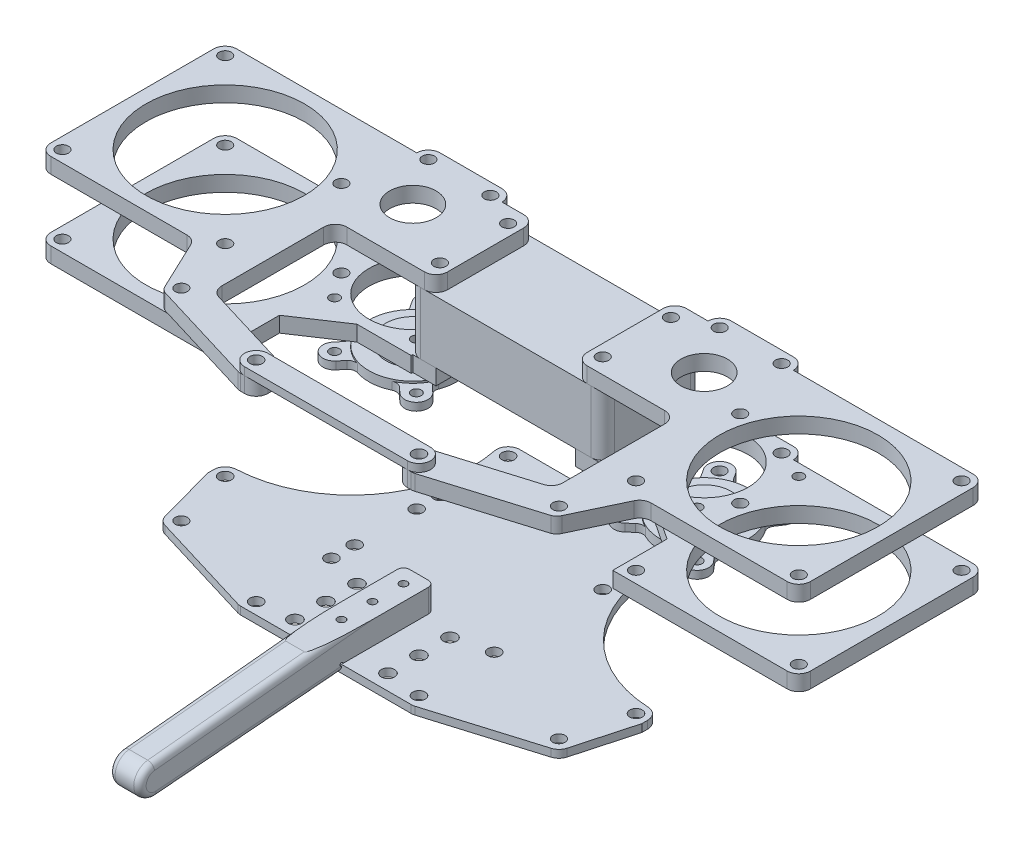
from build123d import *
from build123d.topology import SkipClean

# Parameters (mm, degrees)
BOSS_EXTRUDE1_DEPTH      = 9.525
SKETCH7_R                = 32.5
SKETCH7_R_2              = 9.525
BOSS_EXTRUDE2_DEPTH      = 6.35
SKETCH8_R                = 32.5
SKETCH8_R_2              = 18
BOSS_EXTRUDE3_DEPTH      = 6.35
BOSS_EXTRUDE4_DEPTH      = 6.35
BOSS_EXTRUDE5_START      = 31.75
BOSS_EXTRUDE5_DEPTH      = 6.35
SKETCH15_R               = 2.4892
CUT_EXTRUDE9_DEPTH       = 178.374267088
SKETCH16_R               = 6.35
CUT_EXTRUDE10_DEPTH      = 9.525
SKETCH19_R               = 2.0193
CUT_EXTRUDE11_DEPTH      = 178.374267088
SKETCH22_R               = 2.0193
CUT_EXTRUDE12_DEPTH      = 6.35
CHAMFER1_SIZE            = 12.7
CHAMFER1_SIZE2           = 19.05
SKETCH17_R               = 6.35
BOSS_EXTRUDE6_DEPTH      = 76.2
SKETCH24_W               = 76.2
SKETCH24_H               = 114.3
SKETCH24_R               = 2.5527
BOSS_EXTRUDE8_DEPTH      = 3.175
SKETCH25_W               = 25.4
SKETCH25_H               = 50.8
CUT_EXTRUDE13_DEPTH      = 178.374267088
SKETCH34_R               = 2.0193
CUT_EXTRUDE20_DEPTH      = 6.35
SKETCH21_R               = 2.5527
SKETCH21_R_2             = 2.4892
BOSS_EXTRUDE7_DEPTH      = 3.175
SKETCH26_W               = 57.15
SKETCH26_H               = 41.275
SKETCH26_R               = 18
BOSS_EXTRUDE9_DEPTH      = 9.525
SKETCH27_R               = 2.5527
CUT_EXTRUDE14_DEPTH      = 192.897168101
SKETCH28_W               = 11.1125
SKETCH28_H               = 4.7625
CUT_EXTRUDE15_DEPTH      = 228.583503906
SKETCH30_R               = 2.5527
CUT_EXTRUDE16_DEPTH      = 194.284236941
CUT_EXTRUDE17_REACH      = 193.897
CUT_EXTRUDE17_END_RADIUS = 18
SKETCH31_R               = 2.0193
SKETCH32_W               = 57.15
SKETCH32_H               = 0.254
CUT_EXTRUDE18_DEPTH      = 228.583503906
CUT_EXTRUDE19_DEPTH      = 3.175
FILLET1_R                = 4.7625
SKETCH35_R               = 2.0193
SKETCH35_R_2             = 2.4892
BOSS_EXTRUDE10_DEPTH     = 3.175
SKETCH36_R               = 18
BOSS_EXTRUDE11_DEPTH     = 0.762
SKETCH37_R               = 10.9982
BOSS_EXTRUDE12_DEPTH     = 2.413
SKETCH38_R               = 3.9878
CUT_EXTRUDE21_DEPTH      = 182.44784719
FILLET8_R                = 3.175
SKETCH39_R               = 12.7
CUT_EXTRUDE22_DEPTH      = 3.175
SKETCH40_R               = 2.5527
BOSS_EXTRUDE13_DEPTH     = 6.35
CUT_EXTRUDE23_DEPTH      = 6.35
SKETCH43_W               = 79.375
SKETCH43_H               = 40.64
SKETCH43_R               = 2.4892
BOSS_EXTRUDE14_DEPTH     = 25.4
FILLET2_R                = 4.7625
FILLET3_R                = 4.7625
FILLET4_R                = 4.7625
BOSS_EXTRUDE15_DEPTH     = 6.35
SKETCH45_R               = 2.7051
CUT_EXTRUDE24_DEPTH      = 3.175
CUT_EXTRUDE25_DEPTH      = 3.175
FILLET5_R                = 4.7625
SKETCH47_R               = 2.5527
BOSS_EXTRUDE16_DEPTH     = 3.175
LPATTERN1_COUNT          = 2
LPATTERN1_PITCH          = 19.05
LPATTERN1_COL_COUNT      = 2
LPATTERN1_COL_PITCH      = 19.05
FILLET6_R                = 2.54
FILLET7_R                = 2.54
CUT_SWEEP1_PROFILE_R     = 0.635
SKETCH58_R               = 1.5875
CUT_EXTRUDE26_DEPTH      = 9.525


with BuildPart() as part:
    # Sketch6 → Boss-Extrude1 (new body)
    with BuildSketch(Plane(origin=(28.575, 0, 0), x_dir=(0, 0, -1), z_dir=(1, 0, 0))):
        Polygon((-76.2, 60.325), (-66.04, 92.075), (-62.865, 92.075), (-62.865, 85.725), (-34.29, 85.725), (-34.29, 92.075), (-2.54, 92.075), (-2.54, 85.725), (38.1, 85.725), (38.1, 60.325), (-2.54, 60.325), (-2.54, 53.975), (-76.2, 53.975), align=None)
    extrude(amount=BOSS_EXTRUDE1_DEPTH)

    # Sketch16 → Cut-Extrude10 (cut)
    with BuildSketch(Plane.ZY.offset(-28.575)):
        with Locations((18.415, 76.2)):
            Circle(SKETCH16_R)
    extrude(amount=-CUT_EXTRUDE10_DEPTH, mode=Mode.SUBTRACT)

    # Sketch19 → Cut-Extrude11 (cut, through all)
    with BuildSketch(Plane.XZ.offset(-53.975)):
        with Locations(Location((33.3375, -3.81, 0), (0, 0, 270))):
            Circle(SKETCH19_R)
        with Locations(Location((33.3375, -31.75, 0), (0, 0, 270))):
            Circle(SKETCH19_R)
        with Locations(Location((33.3375, 40.64, 0), (0, 0, 270))):
            Circle(SKETCH19_R)
        with Locations(Location((33.3375, 71.4375, 0), (0, 0, 270))):
            Circle(SKETCH19_R)
        with Locations(Location((33.3375, 56.515, 0), (0, 0, 270))):
            Circle(SKETCH19_R)
    extrude(amount=-CUT_EXTRUDE11_DEPTH, mode=Mode.SUBTRACT)


with BuildPart() as body_2:
    # Sketch7 → Boss-Extrude2 (new body)
    with BuildSketch(Plane(origin=(0, 85.725, 0), x_dir=(1, 0, 0), z_dir=(0, 1, 0))):
        Polygon((28.575, -62.865), (80.340904861, -62.865), (92.075, -38.1), (117.475, -38.1), (155.575, -38.1), (155.575, 38.1), (28.575, 38.1), (28.575, -2.54), (38.1, -2.54), (38.1, -34.29), (28.575, -34.29), align=None)
        with Locations(Location((117.475, 0, 0), (0, 0, 90))):
            Circle(SKETCH7_R, mode=Mode.SUBTRACT)
        with Locations(Location((59.658933489, 19.05, 0), (0, 0, 90))):
            Circle(SKETCH7_R_2, mode=Mode.SUBTRACT)
    extrude(amount=BOSS_EXTRUDE2_DEPTH)

    # Sketch14<2> → Boss-Extrude5 (add)
    with BuildSketch(Plane(origin=(0, 60.325, 0), x_dir=(1, 0, 0), z_dir=(0, 1, 0)).offset(BOSS_EXTRUDE5_START)):
        with BuildLine():
            Line((72.358933489, 42.8625), (46.958933489, 42.8625))
            ThreePointArc((46.958933489, 42.8625), (43.591337443, 34.732403955), (51.721433489, 38.1))
            Line((51.721433489, 38.1), (67.596433489, 38.1))
            ThreePointArc((67.596433489, 38.1), (75.726529534, 34.732403955), (72.358933489, 42.8625))
        make_face()
    extrude(amount=-BOSS_EXTRUDE5_DEPTH)


with BuildPart() as body_3:
    # Sketch8 → Boss-Extrude3 (new body)
    with BuildSketch(Plane(origin=(0, 60.325, 0), x_dir=(-1, 0, 0), z_dir=(0, -1, 0))):
        Polygon((-79.375, -38.1), (-155.575, -38.1), (-155.575, 38.1), (-79.375, 38.1), (-28.575, 38.1), (-28.575, -2.54), (-38.1, -2.54), (-38.1, -3.175), (-79.375, -3.175), align=None)
        with Locations(Location((-117.475, 0, 0), (0, 0, 90))):
            Circle(SKETCH8_R, mode=Mode.SUBTRACT)
        with Locations(Location((-59.658933489, 19.05, 0), (0, 0, 90))):
            Circle(SKETCH8_R_2, mode=Mode.SUBTRACT)
    extrude(amount=BOSS_EXTRUDE3_DEPTH)

    # Sketch14 → Boss-Extrude4 (add)
    with BuildSketch(Plane(origin=(0, 60.325, 0), x_dir=(1, 0, 0), z_dir=(0, 1, 0))):
        with BuildLine():
            Line((72.358933489, 42.8625), (46.958933489, 42.8625))
            ThreePointArc((46.958933489, 42.8625), (43.591337443, 34.732403955), (51.721433489, 38.1))
            Line((51.721433489, 38.1), (67.596433489, 38.1))
            ThreePointArc((67.596433489, 38.1), (75.726529534, 34.732403955), (72.358933489, 42.8625))
        make_face()
    extrude(amount=-BOSS_EXTRUDE4_DEPTH)


with BuildPart() as cut_extrude9_tool:
    # Sketch15 → Cut-Extrude9 (new, through all)
    with BuildSketch(Plane.XZ.offset(-53.975)):
        with Locations(Location((46.958933489, -38.1, 0), (0, 0, 270))):
            Circle(SKETCH15_R)
        with Locations(Location((72.358933489, -38.1, 0), (0, 0, 270))):
            Circle(SKETCH15_R)
        with Locations(Location((81.681121209, -11.793839189, 0), (0, 0, 270))):
            Circle(SKETCH15_R)
        with Locations(Location((150.8125, -33.3375, 0), (0, 0, 270))):
            Circle(SKETCH15_R)
        with Locations(Location((150.8125, 33.3375, 0), (0, 0, 270))):
            Circle(SKETCH15_R)
        with Locations(Location((84.1375, 33.3375, 0), (0, 0, 270))):
            Circle(SKETCH15_R)
        with Locations(Location((33.3375, -31.75, 0), (0, 0, 270))):
            Circle(SKETCH15_R)
        with Locations(Location((33.3375, -3.81, 0), (0, 0, 270))):
            Circle(SKETCH15_R)
        with Locations(Location((33.3375, 40.64, 0), (0, 0, 270))):
            Circle(SKETCH15_R)
        with Locations(Location((77.327408996, 58.1025, 0), (0, 0, 270))):
            Circle(SKETCH15_R)
        with Locations(Location((33.3375, 56.515, 0), (0, 0, 270))):
            Circle(SKETCH15_R)
        with BuildLine():
            Line((150.8125, 38.1), (155.575, 38.1))
            Line((155.575, 38.1), (155.575, 33.3375))
            ThreePointArc((155.575, 33.3375), (154.180096045, 36.705096045), (150.8125, 38.1))
        make_face()
        with BuildLine():
            Line((150.8125, -38.1), (155.575, -38.1))
            Line((155.575, -38.1), (155.575, -33.3375))
            ThreePointArc((155.575, -33.3375), (154.180096045, -36.705096045), (150.8125, -38.1))
        make_face()
    extrude(amount=-CUT_EXTRUDE9_DEPTH)


with BuildPart() as body_3_1:
    add(body_3.part)

    # Cut-Extrude9: cut by cut_extrude9_tool
    add(cut_extrude9_tool.part, mode=Mode.SUBTRACT)

    # Sketch22 → Cut-Extrude12 (cut)
    with BuildSketch(Plane.XZ.offset(-53.975)):
        with Locations(Location((84.1375, -33.3375, 0), (0, 0, 270))):
            Circle(SKETCH22_R)
    extrude(amount=-CUT_EXTRUDE12_DEPTH, mode=Mode.SUBTRACT)

    # Chamfer1
    chamfer1_edges = [body_3_1.edges().sort_by_distance(p)[0] for p in [
        (79.375, 57.15, 3.175),
    ]]
    chamfer1_side = [body_3_1.faces().sort_by_distance(p)[0] for p in [
        (79.375, 57.15, 20.6375),
    ]]
    chamfer(chamfer1_edges, length=CHAMFER1_SIZE, length2=CHAMFER1_SIZE2, reference=chamfer1_side[0])


with BuildPart() as body_2_1:
    add(body_2.part)

    # Cut-Extrude9: cut by cut_extrude9_tool
    add(cut_extrude9_tool.part, mode=Mode.SUBTRACT)


with BuildPart() as body_4:
    # Mirror2: mirrored copy
    add(part.part.mirror(Plane(origin=(0, 0, 0), x_dir=(0, 0, 1), z_dir=(1, 0, 0))))


with BuildPart() as body_5:
    # Mirror2 2: mirrored copy
    add(body_2_1.part.mirror(Plane(origin=(0, 0, 0), x_dir=(0, 0, 1), z_dir=(1, 0, 0))))


with BuildPart() as body_6:
    # Mirror2 3: mirrored copy
    add(body_3_1.part.mirror(Plane(origin=(0, 0, 0), x_dir=(0, 0, 1), z_dir=(1, 0, 0))))


with BuildPart() as body_7:
    # Sketch17 → Boss-Extrude6 (new body)
    with BuildSketch(Plane(origin=(38.1, 0, 0), x_dir=(0, 0, -1), z_dir=(1, 0, 0))):
        with Locations((-18.415, 76.2)):
            Circle(SKETCH17_R)
    extrude(amount=-BOSS_EXTRUDE6_DEPTH)


with BuildPart() as body_8:
    # Sketch24 → Boss-Extrude8 (new body)
    with BuildSketch(Plane.XZ.offset(-53.975)):
        with Locations((0, 19.05)):
            Rectangle(SKETCH24_W, SKETCH24_H)
        with Locations(Location((-33.3375, 71.4375, 0), (0, 0, 270))):
            Circle(SKETCH24_R, mode=Mode.SUBTRACT)
        with Locations(Location((33.3375, 71.4375, 0), (0, 0, 270))):
            Circle(SKETCH24_R, mode=Mode.SUBTRACT)
        with Locations(Location((33.3375, 40.64, 0), (0, 0, 270))):
            Circle(SKETCH24_R, mode=Mode.SUBTRACT)
        with Locations(Location((-33.3375, 40.64, 0), (0, 0, 270))):
            Circle(SKETCH24_R, mode=Mode.SUBTRACT)
        with Locations(Location((-33.3375, -3.81, 0), (0, 0, 270))):
            Circle(SKETCH24_R, mode=Mode.SUBTRACT)
        with Locations(Location((33.3375, -3.81, 0), (0, 0, 270))):
            Circle(SKETCH24_R, mode=Mode.SUBTRACT)
        with Locations(Location((33.3375, -31.75, 0), (0, 0, 270))):
            Circle(SKETCH24_R, mode=Mode.SUBTRACT)
        with Locations(Location((-33.3375, -31.75, 0), (0, 0, 270))):
            Circle(SKETCH24_R, mode=Mode.SUBTRACT)
        with Locations(Location((33.3375, 56.515, 0), (0, 0, 270))):
            Circle(SKETCH24_R, mode=Mode.SUBTRACT)
        with Locations(Location((-33.3375, 56.515, 0), (0, 0, 270))):
            Circle(SKETCH24_R, mode=Mode.SUBTRACT)
    extrude(amount=BOSS_EXTRUDE8_DEPTH)

    # Sketch25 → Cut-Extrude13 (cut, through all)
    with BuildSketch(Plane(origin=(0, 53.975, 0), x_dir=(1, 0, 0), z_dir=(0, 1, 0))):
        with Locations((-6.35, -18.415)):
            Rectangle(SKETCH25_W, SKETCH25_H)
    extrude(amount=-CUT_EXTRUDE13_DEPTH, mode=Mode.SUBTRACT)


with BuildPart() as cut_extrude20_tool:
    # Sketch34 → Cut-Extrude20 (new body)
    with BuildSketch(Plane.XZ.offset(-53.975)):
        with Locations(Location((74.26004646, -1.5875, 0), (0, 0, 270))):
            Circle(SKETCH34_R)
        with Locations(Location((-74.26004646, -1.5875, 0), (0, 0, 270))):
            Circle(SKETCH34_R)
        with Locations(Location((42.8625, -3.687343058, 0), (0, 0, 270))):
            Circle(SKETCH34_R)
        with Locations(Location((-42.8625, -3.687343058, 0), (0, 0, 270))):
            Circle(SKETCH34_R)
    extrude(amount=-CUT_EXTRUDE20_DEPTH)


with BuildPart() as body_3_2:
    add(body_3_1.part)

    # Cut-Extrude20: cut by cut_extrude20_tool
    add(cut_extrude20_tool.part, mode=Mode.SUBTRACT)


with BuildPart() as body_6_1:
    add(body_6.part)

    # Cut-Extrude20: cut by cut_extrude20_tool
    add(cut_extrude20_tool.part, mode=Mode.SUBTRACT)


with BuildPart() as body_9:
    # Sketch21 → Boss-Extrude7 (new body)
    with BuildSketch(Plane(origin=(0, 9.525, 0), x_dir=(-1, 0, 0), z_dir=(0, -1, 0))):
        Polygon((-88.9, -35.71875), (-88.9, 38.251152997), (-33.263104096, 36.5125), (33.263104096, 36.5125), (88.9, 38.251152997), (88.9, -35.71875), (81.599955368, -62.265473852), (35.632311037, -76.2), (34.925, -76.2), (-34.925, -76.2), (-35.632311037, -76.2), (-81.599955368, -62.265473852), align=None)
        with Locations(Location((-84.1375, 33.3375, 0), (0, 0, 90))):
            Circle(SKETCH21_R, mode=Mode.SUBTRACT)
        with Locations(Location((-84.1375, -33.3375, 0), (0, 0, 90))):
            Circle(SKETCH21_R, mode=Mode.SUBTRACT)
        with Locations(Location((-33.3375, 31.75, 0), (0, 0, 90))):
            Circle(SKETCH21_R, mode=Mode.SUBTRACT)
        with Locations(Location((-33.3375, 3.81, 0), (0, 0, 90))):
            Circle(SKETCH21_R, mode=Mode.SUBTRACT)
        with Locations(Location((-33.3375, -40.64, 0), (0, 0, 90))):
            Circle(SKETCH21_R, mode=Mode.SUBTRACT)
        with Locations(Location((-33.3375, -71.4375, 0), (0, 0, 90))):
            Circle(SKETCH21_R, mode=Mode.SUBTRACT)
        with Locations(Location((33.3375, -71.4375, 0), (0, 0, 90))):
            Circle(SKETCH21_R, mode=Mode.SUBTRACT)
        with Locations(Location((33.3375, -40.64, 0), (0, 0, 90))):
            Circle(SKETCH21_R, mode=Mode.SUBTRACT)
        with Locations(Location((33.3375, 3.81, 0), (0, 0, 90))):
            Circle(SKETCH21_R, mode=Mode.SUBTRACT)
        with Locations(Location((33.3375, 31.75, 0), (0, 0, 90))):
            Circle(SKETCH21_R, mode=Mode.SUBTRACT)
        with Locations(Location((84.1375, 33.3375, 0), (0, 0, 90))):
            Circle(SKETCH21_R, mode=Mode.SUBTRACT)
        with Locations(Location((84.1375, -33.3375, 0), (0, 0, 90))):
            Circle(SKETCH21_R, mode=Mode.SUBTRACT)
        with Locations(Location((-77.327408996, -58.1025, 0), (0, 0, 90))):
            Circle(SKETCH21_R_2, mode=Mode.SUBTRACT)
        with Locations(Location((-74.26004646, 1.5875, 0), (0, 0, 90))):
            Circle(SKETCH21_R, mode=Mode.SUBTRACT)
        with Locations(Location((74.26004646, 1.5875, 0), (0, 0, 90))):
            Circle(SKETCH21_R, mode=Mode.SUBTRACT)
        with Locations(Location((-42.8625, 3.687343058, 0), (0, 0, 90))):
            Circle(SKETCH21_R, mode=Mode.SUBTRACT)
        with Locations(Location((42.8625, 3.687343058, 0), (0, 0, 90))):
            Circle(SKETCH21_R, mode=Mode.SUBTRACT)
        with Locations(Location((77.327408996, -58.1025, 0), (0, 0, 90))):
            Circle(SKETCH21_R_2, mode=Mode.SUBTRACT)
    extrude(amount=BOSS_EXTRUDE7_DEPTH)

    # Sketch30 → Cut-Extrude16 (cut, through all)
    with BuildSketch(Plane.XZ.offset(-6.35)):
        with Locations(Location((-33.3375, 31.115, 0), (0, 0, 270))):
            Circle(SKETCH30_R)
        with Locations(Location((-33.3375, 5.715, 0), (0, 0, 270))):
            Circle(SKETCH30_R)
    extrude(amount=-CUT_EXTRUDE16_DEPTH, mode=Mode.SUBTRACT)

    # Sketch33 → Cut-Extrude19 (cut)
    with BuildSketch(Plane.XZ.offset(-6.35)):
        with BuildLine():
            Line((88.9, -25.200781238), (88.9, 25.200781238))
            ThreePointArc((88.9, 25.200781238), (79.375, 0), (88.9, -25.200781238))
        make_face()
        with BuildLine():
            Line((-88.9, -25.200781238), (-88.9, 25.200781238))
            ThreePointArc((-88.9, 25.200781238), (-79.375, 0), (-88.9, -25.200781238))
        make_face()
    extrude(amount=-CUT_EXTRUDE19_DEPTH, mode=Mode.SUBTRACT)

    # Fillet1
    fillet1_edges = [body_9.edges().sort_by_distance(p)[0] for p in [
        (88.9, 7.9375, -25.200781238),
        (88.9, 7.9375, 25.200781238),
        (-88.9, 7.9375, 25.200781238),
        (-88.9, 7.9375, -25.200781238),
        (88.9, 7.9375, -38.251152997),
        (-88.9, 7.9375, -38.251152997),
        (-81.599955368, 7.9375, 62.265473852),
        (-35.632311037, 7.9375, 76.2),
        (35.632311037, 7.9375, 76.2),
        (81.599955368, 7.9375, 62.265473852),
    ]]
    fillet(fillet1_edges, radius=FILLET1_R)

    # Sketch39 → Cut-Extrude22 (cut)
    with BuildSketch(Plane.XZ.offset(-6.35)):
        with Locations(Location((-59.658933489, -19.05, 0), (0, 0, 270))):
            Circle(SKETCH39_R)
        with Locations(Location((59.658933489, -19.05, 0), (0, 0, 270))):
            Circle(SKETCH39_R)
    extrude(amount=-CUT_EXTRUDE22_DEPTH, mode=Mode.SUBTRACT)

    # Sketch45 → Cut-Extrude24 (cut)
    with BuildSketch(Plane.XZ.offset(-6.35)):
        with Locations(Location((0, 44.45, 0), (0, 0, 270))):
            Circle(SKETCH45_R)
        with Locations(Location((0, 57.15, 0), (0, 0, 270))):
            Circle(SKETCH45_R)
        with Locations(Location((0, 69.85, 0), (0, 0, 270))):
            Circle(SKETCH45_R)
    cut_extrude24 = extrude(amount=-CUT_EXTRUDE24_DEPTH, mode=Mode.SUBTRACT)

    # Sketch46 → Cut-Extrude25 (cut)
    with BuildSketch(Plane.XZ.offset(-6.35)):
        with BuildLine():
            ThreePointArc((-88.9, 28.579513852), (-47.105461685, 9.009143374), (-39.518445268, -36.5125))
            ThreePointArc((-39.518445268, -36.5125), (-126.13961151, -50.94950538), (-88.9, 28.579513852))
        make_face()
    cut_extrude25 = extrude(amount=-CUT_EXTRUDE25_DEPTH, mode=Mode.SUBTRACT)

    # Mirror4: Cut-Extrude25 across plane
    add(cut_extrude25.mirror(Plane(origin=(0, 0, 0), x_dir=(0, 0, 1), z_dir=(1, 0, 0))), mode=Mode.SUBTRACT)

    # Fillet5
    # the kernel refuses this fillet: 4.7625 mm, written as the material it takes off along each edge
    with BuildSketch(Plane(origin=(-88.9, -5.54496537, 28.579513852), x_dir=(0, 0, 1), z_dir=(0, 1, 0))) as fillet5_piece_1:
        with BuildLine():
            CenterArc((4.757986148, 4.7625), FILLET5_R, 182.619939868, 87.380060132)
            Line((0.000464283, 4.54480306), (-0.094686154, 4.540449122))
            ThreePointArc((-0.094686154, 4.540449122), (-0.0429381, 2.27240594), (-0.095149546, 0.004373379))
            Line((-0.095149546, 0.004373379), (0, -0.09525))
            Line((0, -0.09525), (4.757986148, -0.09525))
            Line((4.757986148, -0.09525), (4.757986148, 0))
        make_face()
    extrude(amount=26.964930741, mode=Mode.SUBTRACT)
    with BuildSketch(Plane(origin=(88.9, -5.54496537, 28.579513852), x_dir=(0, 0, 1), z_dir=(0, 1, 0))) as fillet5_piece_2:
        with BuildLine():
            CenterArc((4.757986148, -4.7625), FILLET5_R, 90, 87.380060132)
            Line((0.000464283, -4.54480306), (-0.094686154, -4.540449122))
            ThreePointArc((-0.094686154, -4.540449122), (-0.0429381, -2.27240594), (-0.095149546, -0.004373379))
            Line((-0.095149546, -0.004373379), (0, 0.09525))
            Line((0, 0.09525), (4.757986148, 0.09525))
            Line((4.757986148, 0.09525), (4.757986148, 0))
        make_face()
    extrude(amount=26.964930741, mode=Mode.SUBTRACT)
    with BuildSketch(Plane(origin=(39.584081734, 25.335158249, -36.710030551), x_dir=(-0.999512076087079, 0, 0.031234752377718233), z_dir=(0, -1, 0))) as fillet5_piece_3:
        with BuildLine():
            CenterArc((6.398323114, -4.761921013), FILLET5_R, 90.893427068, 102.333962985)
            Line((1.762174005, -5.851658451), (1.669451023, -5.8734532))
            ThreePointArc((1.669451023, -5.8734532), (0.880087853, -2.92613011), (-0.089339106, -0.033031602))
            Line((-0.089339106, -0.033031602), (0, 0.09525))
            Line((0, 0.09525), (6.322578103, 0.09523842))
            Line((6.322578103, 0.09523842), (6.3240633, 0))
        make_face()
    extrude(amount=34.795316498, mode=Mode.SUBTRACT)
    with BuildSketch(Plane(origin=(-39.584081734, 25.335158249, -36.710030551), x_dir=(0.25830126253387015, 0, 0.9660644169895757), z_dir=(0, -1, 0))) as fillet5_piece_4:
        with BuildLine():
            CenterArc((6.404615335, -4.75345483), FILLET5_R, 93.531809473, 102.333962985)
            Line((1.823543741, -6.055449186), (1.731922309, -6.081489073))
            Line((1.731922309, -6.081489073), (-0.091204263, -0.027465339))
            Line((-0.091204263, -0.027465339), (0.005867655, 0.095069097))
            ThreePointArc((0.005867655, 0.095069097), (3.055616298, 0.001043471), (6.105364942, 0.095069097))
            Line((6.105364942, 0.095069097), (6.111232597, 0))
        make_face()
    extrude(amount=34.795316498, mode=Mode.SUBTRACT)

    # LPattern1: Cut-Extrude24 ×2
    with Locations(*[(i * LPATTERN1_PITCH, 0, 0) for i in range(1, LPATTERN1_COUNT)]):
        add(cut_extrude24, mode=Mode.SUBTRACT)

    # LPattern1 col: Cut-Extrude24 ×2
    with Locations(*[(-i * LPATTERN1_COL_PITCH, 0, 0) for i in range(1, LPATTERN1_COL_COUNT)]):
        add(cut_extrude24, mode=Mode.SUBTRACT)


with BuildPart() as body_10:
    # Sketch26 → Boss-Extrude9 (new body)
    with BuildSketch(Plane.ZY.offset(38.1)):
        with Locations((18.415, 30.1625)):
            Rectangle(SKETCH26_W, SKETCH26_H)
        with Locations((18.415, 28.575)):
            Circle(SKETCH26_R, mode=Mode.SUBTRACT)
    extrude(amount=-BOSS_EXTRUDE9_DEPTH)

    # Sketch27 → Cut-Extrude14 (cut, through all)
    with BuildSketch(Plane.XZ.offset(-9.525)):
        with Locations(Location((-33.3375, -3.81, 0), (0, 0, 270))):
            Circle(SKETCH27_R)
        with Locations(Location((-33.3375, 40.64, 0), (0, 0, 270))):
            Circle(SKETCH27_R)
    extrude(amount=-CUT_EXTRUDE14_DEPTH, mode=Mode.SUBTRACT)

    # Sketch28 → Cut-Extrude15 (cut, through all)
    with BuildSketch(Plane.ZY.offset(38.1)):
        with Locations((-4.60375, 11.90625)):
            Rectangle(SKETCH28_W, SKETCH28_H)
        with Locations((41.43375, 11.90625)):
            Rectangle(SKETCH28_W, SKETCH28_H)
    extrude(amount=-CUT_EXTRUDE15_DEPTH, mode=Mode.SUBTRACT)

    # Cut-Extrude17: up to this cylinder (the profile starts outside it)
    cut_extrude17_end = Plane(origin=(-33.3375, 28.575, 18.415), z_dir=(-1, 0, 0)) * Cylinder(CUT_EXTRUDE17_END_RADIUS, 424.794, mode=Mode.PRIVATE)
    # Sketch31 → Cut-Extrude17 (cut, up to the surface)
    with BuildSketch(Plane.XZ.offset(-9.525), mode=Mode.PRIVATE) as cut_extrude17_sk1:
        with Locations(Location((-33.3375, 5.715, 0), (0, 0, 270))):
            Circle(SKETCH31_R)
    cut_extrude17_tool1 = extrude(cut_extrude17_sk1.sketch, amount=-CUT_EXTRUDE17_REACH, mode=Mode.PRIVATE) - cut_extrude17_end
    add(cut_extrude17_tool1.solids().sort_by_distance((-33.3375, 9.525, 5.715))[0], mode=Mode.SUBTRACT)
    # Sketch31 → Cut-Extrude17 (cut, up to the surface)
    with BuildSketch(Plane.XZ.offset(-9.525), mode=Mode.PRIVATE) as cut_extrude17_sk2:
        with Locations(Location((-33.3375, 31.115, 0), (0, 0, 270))):
            Circle(SKETCH31_R)
    cut_extrude17_tool2 = extrude(cut_extrude17_sk2.sketch, amount=-CUT_EXTRUDE17_REACH, mode=Mode.PRIVATE) - cut_extrude17_end
    add(cut_extrude17_tool2.solids().sort_by_distance((-33.3375, 9.525, 31.115))[0], mode=Mode.SUBTRACT)

    # Sketch32 → Cut-Extrude18 (cut, through all)
    with BuildSketch(Plane.ZY.offset(38.1)):
        with Locations((18.415, 28.575)):
            Rectangle(SKETCH32_W, SKETCH32_H)
    extrude(amount=-CUT_EXTRUDE18_DEPTH, mode=Mode.SUBTRACT)


with BuildPart() as cut_extrude18_piece_1:
    # of the separate pieces the step leaves, piece 1, a body of its own (cut_extrude18_pieces)
    add(body_10.part.solids().sort_by_distance((-38.1, 50.8, -10.16))[0])


with BuildPart() as cut_extrude18_piece_2:
    # of the separate pieces the step leaves, piece 2, a body of its own (cut_extrude18_pieces)
    add(body_10.part.solids().sort_by_distance((-38.1, 9.525, 0.9525))[0])


with BuildPart() as body_12:
    # Sketch35 → Boss-Extrude10 (new body)
    with BuildSketch(Plane(origin=(0, 41.275, 0), x_dir=(-1, 0, 0), z_dir=(0, -1, 0))):
        with BuildLine():
            Line((-77.913650249, 4.642428085), (-74.447248762, 8.788141914))
            ThreePointArc((-74.447248762, 8.788141914), (-77.632505883, 20.025036096), (-73.250353492, 30.85141103))
            Line((-73.250353492, 30.85141103), (-76.321573015, 35.458240315))
            ThreePointArc((-76.321573015, 35.458240315), (-75.000693173, 42.062639527), (-68.396293962, 40.741759685))
            Line((-68.396293962, 40.741759685), (-65.325074438, 36.134930399))
            ThreePointArc((-65.325074438, 36.134930399), (-59.658933489, 37.05), (-53.992792539, 36.134930399))
            Line((-53.992792539, 36.134930399), (-50.921573015, 40.741759685))
            ThreePointArc((-50.921573015, 40.741759685), (-44.317173804, 42.062639527), (-42.996293962, 35.458240315))
            Line((-42.996293962, 35.458240315), (-46.067513485, 30.85141103))
            ThreePointArc((-46.067513485, 30.85141103), (-41.790487399, 21.222241781), (-43.635822547, 10.848785714))
            Line((-43.635822547, 10.848785714), (-39.648237345, 7.201588615))
            ThreePointArc((-39.648237345, 7.201588615), (-39.348254443, 0.473080403), (-46.076762655, 0.173097501))
            Line((-46.076762655, 0.173097501), (-50.064347857, 3.8202946))
            ThreePointArc((-50.064347857, 3.8202946), (-58.45779099, 1.090120916), (-67.140041184, 2.678285745))
            Line((-67.140041184, 2.678285745), (-70.606442671, -1.467428085))
            ThreePointArc((-70.606442671, -1.467428085), (-77.314974544, -2.066103789), (-77.913650249, 4.642428085))
        make_face()
        with Locations(Location((-74.26004646, 1.5875, 0), (0, 0, 90))):
            Circle(SKETCH35_R, mode=Mode.SUBTRACT)
        with Locations(Location((-42.8625, 3.687343058, 0), (0, 0, 90))):
            Circle(SKETCH35_R, mode=Mode.SUBTRACT)
        with Locations(Location((-46.958933489, 38.1, 0), (0, 0, 90))):
            Circle(SKETCH35_R_2, mode=Mode.SUBTRACT)
        with Locations(Location((-72.358933489, 38.1, 0), (0, 0, 90))):
            Circle(SKETCH35_R_2, mode=Mode.SUBTRACT)
    extrude(amount=BOSS_EXTRUDE10_DEPTH)

    # Sketch36 → Boss-Extrude11 (add)
    with SkipClean():  # the faces are left unmerged after this step: merging them gives an invalid solid
        with BuildSketch(Plane(origin=(0, 41.275, 0), x_dir=(1, 0, 0), z_dir=(0, 1, 0))):
            with Locations(Location((59.658933489, 19.05, 0), (0, 0, 294.558183853))):
                Circle(SKETCH36_R)
        extrude(amount=BOSS_EXTRUDE11_DEPTH)

    # Sketch37 → Boss-Extrude12 (add)
    with SkipClean():  # the faces are left unmerged after this step: merging them gives an invalid solid
        with BuildSketch(Plane(origin=(0, 42.037, 0), x_dir=(1, 0, 0), z_dir=(0, 1, 0))):
            with Locations(Location((59.658933489, 19.05, 0), (0, 0, 90))):
                Circle(SKETCH37_R)
        extrude(amount=BOSS_EXTRUDE12_DEPTH)

    # Sketch38 → Cut-Extrude21 (cut, through all)
    with SkipClean():  # the faces are left unmerged after this step: merging them gives an invalid solid
        with BuildSketch(Plane.XZ.offset(-38.1)):
            with Locations(Location((59.658933489, -19.05, 0), (0, 0, 270))):
                Circle(SKETCH38_R)
        extrude(amount=-CUT_EXTRUDE21_DEPTH, mode=Mode.SUBTRACT)

    # Fillet8
    # the kernel refuses this fillet: 3.175 mm, written as the material it adds along each edge
    with BuildSketch(Plane(origin=(74.447248762, 41.275, -8.788141914), x_dir=(0.52132134384505, 0, -0.8533604493129449), z_dir=(0, -1, 0)), Plane(origin=(65.325074438, 41.275, -36.134930399), x_dir=(-0.9658744295384044, 0, -0.259010784261702), z_dir=(0, -1, 0))) as fillet8_piece_1:
        with BuildLine():
            CenterArc((2.279983772, 3.169618201), FILLET8_R, 198.67869384, 67.984808193)
            Line((-0.727787188, 2.152790363), (0, 0))
            ThreePointArc((0, 0), (1.047599436, 0.030510986), (2.095198871, 0))
        make_face()
    extrude(amount=3.175)
    with BuildSketch(Plane(origin=(73.250353492, 41.275, -30.85141103), x_dir=(0.5547001962252291, 0, -0.8320502943378437), z_dir=(0, -1, 0)), Plane(origin=(53.992792539, 41.275, -36.134930399), x_dir=(-0.5547001962252269, 0, -0.8320502943378452), z_dir=(0, -1, 0))) as fillet8_piece_2:
        with BuildLine():
            CenterArc((2.272483342, 3.175), FILLET8_R, 202.015191807, 67.984808193)
            ThreePointArc((-0.671009933, 1.984843566), (-0.306601011, 1.002193254), (0, 0))
            Line((0, 0), (2.272483342, 0))
        make_face()
    extrude(amount=3.175)
    with BuildSketch(Plane(origin=(46.067513485, 41.275, -30.85141103), x_dir=(-0.5547001962252291, 0, -0.8320502943378437), z_dir=(0, -1, 0)), Plane(origin=(50.064347857, 41.275, -3.8202946), x_dir=(-0.7378993295380093, 0, 0.6749107937108108), z_dir=(0, -1, 0))) as fillet8_piece_3:
        with BuildLine():
            CenterArc((2.272483342, -3.175), FILLET8_R, 90, 67.984808193)
            ThreePointArc((-0.671009933, -1.984843566), (-0.306601011, -1.002193254), (0, 0))
            Line((0, 0), (2.272483342, 0))
        make_face()
    extrude(amount=3.175)
    with BuildSketch(Plane(origin=(43.635822547, 41.275, -10.848785714), x_dir=(-0.4030426791197312, 0, -0.9151811835958983), z_dir=(0, -1, 0)), Plane(origin=(67.140041184, 41.275, -2.678285745), x_dir=(-0.9321868631122348, 0, 0.36197741951808465), z_dir=(0, -1, 0))) as fillet8_piece_4:
        with BuildLine():
            CenterArc((2.279983772, -3.169618201), FILLET8_R, 93.336497967, 67.984808193)
            Line((-0.727787188, -2.152790363), (0, 0))
            ThreePointArc((0, 0), (1.047599436, -0.030510986), (2.095198871, 0))
        make_face()
    extrude(amount=3.175)


with BuildPart() as body_13:
    # Mirror3: mirrored copy
    add(body_12.part.mirror(Plane(origin=(0, 0, 0), x_dir=(0, 0, 1), z_dir=(1, 0, 0))))


with BuildPart() as body_2_2:
    add(body_2_1.part)

    add(body_5.part)  # Boss-Extrude13 merges body 5
    # Sketch40 → Boss-Extrude13 (add)
    # profile 1 of 2: a face of its own
    with BuildSketch(Plane(origin=(0, 92.075, 0), x_dir=(1, 0, 0), z_dir=(0, 1, 0))):
        with BuildLine():
            Line((34.926326644, -76.2), (28.575, -76.2))
            Line((28.575, -76.2), (28.575, -62.865))
            Line((28.575, -62.865), (80.340904861, -62.865))
            Line((80.340904861, -62.865), (79.086032242, -63.027538736))
            Line((79.086032242, -63.027538736), (36.307935188, -75.995192846))
            ThreePointArc((36.307935188, -75.995192846), (35.624679731, -76.148519976), (34.926326644, -76.2))
        make_face()
        with Locations(Location((33.3375, -71.4375, 0), (0, 0, 90))):
            Circle(SKETCH40_R, mode=Mode.SUBTRACT)
    # profile 2 of 2: a face of its own
    with BuildSketch(Plane(origin=(0, 92.075, 0), x_dir=(1, 0, 0), z_dir=(0, 1, 0))):
        with BuildLine():
            Line((-36.307935188, -75.995192846), (-79.086032242, -63.027538736))
            Line((-79.086032242, -63.027538736), (-80.340904861, -62.865))
            Line((-80.340904861, -62.865), (-28.575, -62.865))
            Line((-28.575, -62.865), (-28.575, -76.2))
            Line((-28.575, -76.2), (-34.926326644, -76.2))
            ThreePointArc((-34.926326644, -76.2), (-35.624679731, -76.148519976), (-36.307935188, -75.995192846))
        make_face()
        with Locations(Location((-33.3375, -71.4375, 0), (0, 0, 90))):
            Circle(SKETCH40_R, mode=Mode.SUBTRACT)
    extrude(amount=-BOSS_EXTRUDE13_DEPTH)

    # Sketch41 → Cut-Extrude23 (cut)
    with BuildSketch(Plane(origin=(0, 92.075, 0), x_dir=(1, 0, 0), z_dir=(0, 1, 0))):
        Polygon((-69.85, -2.54), (69.85, -2.54), (69.85, -52.556633707), (28.575, -65.068642428), (-28.575, -65.068642428), (-69.85, -52.556633707), align=None)
    extrude(amount=-CUT_EXTRUDE23_DEPTH, mode=Mode.SUBTRACT)

    # Fillet3
    # the kernel refuses this fillet: 4.7625 mm, written as the material it adds along each edge
    with BuildSketch(Plane(origin=(-92.075, 85.725, 38.1), x_dir=(-1, 0, 0), z_dir=(0, 1, 0))) as fillet3_piece_1:
        with BuildLine():
            CenterArc((FILLET3_R * 0.632755037391, FILLET3_R), FILLET3_R, 205.352421995, 64.647578005)
            Line((-FILLET3_R * 0.270936128646, FILLET3_R * 0.571815137555), (0, 0))
            Line((0, 0), (FILLET3_R * 0.632755037391, 0))
        make_face()
    extrude(amount=6.35)
    with BuildSketch(Plane(origin=(-69.85, 92.075, 52.556633707), x_dir=(0.9569958732541437, 0, 0.2901015314929221), z_dir=(0, -1, 0))) as fillet3_piece_2:
        with BuildLine():
            CenterArc((FILLET3_R * 0.741798881633, -FILLET3_R), FILLET3_R, 90, 73.135965338)
            Line((-FILLET3_R * 0.215196991621, -FILLET3_R * 0.709898468507), (0, 0))
            Line((0, 0), (FILLET3_R * 0.741798881633, 0))
        make_face()
    extrude(amount=6.35)
    with BuildSketch(Plane(origin=(-69.85, 92.075, 2.54), x_dir=(0, 0, 1), z_dir=(0, -1, 0))) as fillet3_piece_3:
        with BuildLine():
            CenterArc((FILLET3_R, -FILLET3_R), FILLET3_R, 90, 90)
            Line((0, -FILLET3_R), (0, 0))
            Line((0, 0), (FILLET3_R, 0))
        make_face()
    extrude(amount=6.35)
    # the kernel refuses this fillet: 4.7625 mm, written as the material it takes off along each edge
    with BuildSketch(Plane(origin=(-80.340904861, 79.93316625, 62.865), x_dir=(0.9917155929763007, 0, 0.12845303673975253), z_dir=(0, 1, 0))) as fillet3_2_piece_1:
        with BuildLine():
            CenterArc((2.753526235, 4.524019632), FILLET3_R, 212.732630361, 39.058810377)
            Line((-1.252702932, 1.948843112), (0, 0))
            Line((0, 0), (1.265355338, 0))
        make_face()
    extrude(amount=17.9336675, mode=Mode.SUBTRACT)
    with BuildSketch(Plane(origin=(-28.575, 103.98125, 76.2), x_dir=(0, 0, -1), z_dir=(0, -1, 0)), Plane(origin=(-28.575, 73.81875, 2.54), x_dir=(-1, 0, 0), z_dir=(0, 1, 0))) as fillet3_2_piece_2:
        with BuildLine():
            CenterArc((FILLET3_R, -FILLET3_R), FILLET3_R, 90, 90)
            Line((0, -FILLET3_R), (0, 0))
            Line((0, 0), (FILLET3_R, 0))
        make_face()
    extrude(amount=30.1625, mode=Mode.SUBTRACT)
    with BuildSketch(Plane(origin=(-28.575, 100.907042934, 65.068642428), x_dir=(0, 0, 1), z_dir=(0, -1, 0))) as fillet3_2_piece_3:
        with BuildLine():
            CenterArc((FILLET3_R * 0.741798881633, FILLET3_R), FILLET3_R, 196.864034662, 73.135965338)
            Line((-FILLET3_R * 0.215196991621, FILLET3_R * 0.709898468507), (0, 0))
            Line((0, 0), (FILLET3_R * 0.741798881633, 0))
        make_face()
    extrude(amount=24.014085869, mode=Mode.SUBTRACT)
    with BuildSketch(Plane(origin=(-28.575, 73.81875, -38.1), x_dir=(-1, 0, 0), z_dir=(0, 1, 0))) as fillet3_2_piece_4:
        with BuildLine():
            CenterArc((FILLET3_R, FILLET3_R), FILLET3_R, 180, 90)
            Line((0, FILLET3_R), (0, 0))
            Line((0, 0), (FILLET3_R, 0))
        make_face()
    extrude(amount=30.1625, mode=Mode.SUBTRACT)

    # Fillet4
    # the kernel refuses this fillet: 4.7625 mm, written as the material it adds along each edge
    with BuildSketch(Plane(origin=(92.075, 85.725, 38.1), x_dir=(1, 0, 0), z_dir=(0, 1, 0))) as fillet4_piece_1:
        with BuildLine():
            CenterArc((FILLET4_R * 0.632755037391, -FILLET4_R), FILLET4_R, 90, 64.647578005)
            Line((-FILLET4_R * 0.270936128646, -FILLET4_R * 0.571815137555), (0, 0))
            Line((0, 0), (FILLET4_R * 0.632755037391, 0))
        make_face()
    extrude(amount=6.35)
    with BuildSketch(Plane(origin=(69.85, 92.075, 52.556633707), x_dir=(-0.9569958732541437, 0, 0.2901015314929221), z_dir=(0, -1, 0))) as fillet4_piece_2:
        with BuildLine():
            CenterArc((FILLET4_R * 0.741798881633, FILLET4_R), FILLET4_R, 196.864034662, 73.135965338)
            Line((-FILLET4_R * 0.215196991621, FILLET4_R * 0.709898468507), (0, 0))
            Line((0, 0), (FILLET4_R * 0.741798881633, 0))
        make_face()
    extrude(amount=6.35)
    with BuildSketch(Plane(origin=(69.85, 92.075, 2.54), x_dir=(0, 0, 1), z_dir=(0, -1, 0))) as fillet4_piece_3:
        with BuildLine():
            CenterArc((FILLET4_R, FILLET4_R), FILLET4_R, 180, 90)
            Line((0, FILLET4_R), (0, 0))
            Line((0, 0), (FILLET4_R, 0))
        make_face()
    extrude(amount=6.35)
    # the kernel refuses this fillet: 4.7625 mm, written as the material it takes off along each edge
    with BuildSketch(Plane(origin=(80.340904861, 79.93316625, 62.865), x_dir=(-0.9917155929763035, 0, 0.12845303673973044), z_dir=(0, 1, 0))) as fillet4_2_piece_1:
        with BuildLine():
            CenterArc((2.753526235, -4.524019632), FILLET4_R, 108.208559262, 39.058810377)
            Line((-1.252702932, -1.948843112), (0, 0))
            Line((0, 0), (1.265355338, 0))
        make_face()
    extrude(amount=17.9336675, mode=Mode.SUBTRACT)
    with BuildSketch(Plane(origin=(28.575, 103.98125, 76.2), x_dir=(0, 0, -1), z_dir=(0, -1, 0)), Plane(origin=(28.575, 73.81875, -38.1), x_dir=(0, 0, 1), z_dir=(0, 1, 0))) as fillet4_2_piece_2:
        with BuildLine():
            CenterArc((FILLET4_R, FILLET4_R), FILLET4_R, 180, 90)
            Line((0, FILLET4_R), (0, 0))
            Line((0, 0), (FILLET4_R, 0))
        make_face()
    extrude(amount=30.1625, mode=Mode.SUBTRACT)
    with BuildSketch(Plane(origin=(28.575, 100.907042934, 65.068642428), x_dir=(0, 0, 1), z_dir=(0, -1, 0))) as fillet4_2_piece_3:
        with BuildLine():
            CenterArc((FILLET4_R * 0.741798881633, -FILLET4_R), FILLET4_R, 90, 73.135965338)
            Line((-FILLET4_R * 0.215196991621, -FILLET4_R * 0.709898468507), (0, 0))
            Line((0, 0), (FILLET4_R * 0.741798881633, 0))
        make_face()
    extrude(amount=24.014085869, mode=Mode.SUBTRACT)
    with BuildSketch(Plane(origin=(28.575, 73.81875, 2.54), x_dir=(0, 0, -1), z_dir=(0, 1, 0))) as fillet4_2_piece_4:
        with BuildLine():
            CenterArc((FILLET4_R, -FILLET4_R), FILLET4_R, 90, 90)
            Line((0, -FILLET4_R), (0, 0))
            Line((0, 0), (FILLET4_R, 0))
        make_face()
    extrude(amount=30.1625, mode=Mode.SUBTRACT)


with BuildPart() as body_7_2:
    # Sketch43 → Boss-Extrude14 (new body)
    with BuildSketch(Plane(origin=(0, 60.325, 0), x_dir=(1, 0, 0), z_dir=(0, 1, 0))):
        with Locations((0, 17.78)):
            Rectangle(SKETCH43_W, SKETCH43_H)
        with Locations(Location((33.3375, 31.75, 0), (0, 0, 90))):
            Circle(SKETCH43_R, mode=Mode.SUBTRACT)
        with Locations(Location((33.3375, 3.81, 0), (0, 0, 90))):
            Circle(SKETCH43_R, mode=Mode.SUBTRACT)
        with Locations(Location((-33.3375, 31.75, 0), (0, 0, 90))):
            Circle(SKETCH43_R, mode=Mode.SUBTRACT)
        with Locations(Location((-33.3375, 3.81, 0), (0, 0, 90))):
            Circle(SKETCH43_R, mode=Mode.SUBTRACT)
    extrude(amount=BOSS_EXTRUDE14_DEPTH)

    # Fillet2
    fillet2_edges = [body_7_2.edges().sort_by_distance(p)[0] for p in [
        (-39.6875, 73.025, -38.1),
        (39.6875, 73.025, -38.1),
        (39.6875, 73.025, 2.54),
        (-39.6875, 73.025, 2.54),
    ]]
    fillet(fillet2_edges, radius=FILLET2_R)


with BuildPart() as body_8_2:
    # Sketch44 → Boss-Extrude15 (new, symmetric)
    with BuildSketch(Plane(origin=(0, 0, 0), x_dir=(0, 0, -1), z_dir=(1, 0, 0))):
        with BuildLine():
            Line((-76.2, 9.525), (-38.1, 9.525))
            Line((-38.1, 9.525), (-38.1, 19.05))
            Line((-38.1, 19.05), (-88.9, 19.05))
            Line((-88.9, 19.05), (-153.028758874, 12.668794369))
            ThreePointArc((-153.028758874, 12.668794369), (-158.723549741, 5.771019278), (-151.870833333, 0.022087023))
            Line((-151.870833333, 0.022087023), (-76.2, 6.35))
            Line((-76.2, 6.35), (-76.2, 9.525))
        make_face()
    extrude(amount=BOSS_EXTRUDE15_DEPTH, both=True)

    # Fillet6
    # the kernel refuses this fillet: 2.54 mm, written as the material it takes off along each edge
    with BuildSketch(Plane(origin=(6.35, 22.193794369, 57.306028155), x_dir=(-1, 0, 0), z_dir=(0, -0.09901714548254267, 0.9950857274127134))) as fillet6_piece_1:
        with BuildLine():
            CenterArc((FILLET6_R, FILLET6_R), FILLET6_R, 180, 90)
            Line((0, FILLET6_R), (0, 0))
            Line((0, 0), (FILLET6_R, 0))
        make_face()
    extrude(amount=96.195461438, mode=Mode.SUBTRACT)
    with BuildSketch(Plane(origin=(6.35, 6.35, 152.4), x_dir=(0, 0.9950857274127135, 0.09901714548254303), z_dir=(0, 0.09901714548254303, -0.9950857274127135))) as fillet6_piece_2:
        with BuildLine():
            CenterArc((6.35 - FILLET6_R, -FILLET6_R), FILLET6_R, 0, 90)
            Line((6.35 - FILLET6_R, 0), (6.35, 0))
            Line((6.35, 0), (6.35, -FILLET6_R))
        make_face()
    revolve(axis=Axis((6.35, 6.35, 152.4), (1, 0, 0)), revolution_arc=179.097615682, mode=Mode.SUBTRACT)
    with BuildSketch(Plane(origin=(6.35, 0.022087023, 151.870833333), x_dir=(-1, 0, 0), z_dir=(0, 0.08333333333333208, -0.9965217285917833))) as fillet6_piece_3:
        with BuildLine():
            CenterArc((FILLET6_R, FILLET6_R), FILLET6_R, 180, 90)
            Line((0, FILLET6_R), (0, 0))
            Line((0, 0), (FILLET6_R, 0))
        make_face()
    extrude(amount=82.284955719, mode=Mode.SUBTRACT)
    with BuildSketch(Plane(origin=(-6.35, 0.022087023, 151.870833333), x_dir=(1, 0, 0), z_dir=(0, 0.08333333333333208, -0.9965217285917833))) as fillet6_piece_4:
        with BuildLine():
            CenterArc((FILLET6_R, -FILLET6_R), FILLET6_R, 90, 90)
            Line((0, -FILLET6_R), (0, 0))
            Line((0, 0), (FILLET6_R, 0))
        make_face()
    extrude(amount=82.284955719, mode=Mode.SUBTRACT)
    with BuildSketch(Plane(origin=(-6.35, 6.35, 152.4), x_dir=(0, 0.9950857274127135, 0.09901714548254303), z_dir=(0, 0.09901714548254303, -0.9950857274127135))) as fillet6_piece_5:
        with BuildLine():
            CenterArc((6.35 - FILLET6_R, FILLET6_R), FILLET6_R, 270, 90)
            Line((6.35 - FILLET6_R, 0), (6.35, 0))
            Line((6.35, 0), (6.35, FILLET6_R))
        make_face()
    revolve(axis=Axis((-6.35, 6.35, 152.4), (1, 0, 0)), revolution_arc=179.097615682, mode=Mode.SUBTRACT)
    with BuildSketch(Plane(origin=(-6.35, 22.193794369, 57.306028155), x_dir=(1, 0, 0), z_dir=(0, -0.09901714548254267, 0.9950857274127134))) as fillet6_piece_6:
        with BuildLine():
            CenterArc((FILLET6_R, -FILLET6_R), FILLET6_R, 90, 90)
            Line((0, -FILLET6_R), (0, 0))
            Line((0, 0), (FILLET6_R, 0))
        make_face()
    extrude(amount=96.195461438, mode=Mode.SUBTRACT)

    # Fillet7
    fillet7_edges = [body_8_2.edges().sort_by_distance(p)[0] for p in [
        (6.35, 14.2875, 38.1),
        (-6.35, 14.2875, 38.1),
    ]]
    fillet(fillet7_edges, radius=FILLET7_R)

    # Cut-Sweep1: sweep along a path in Sketch48
    with BuildLine(Plane.XZ.offset(-9.525)) as cut_sweep1_path:
        Line((6.35, 76.2), (-6.35, 76.2))
    # Cut-Sweep1 profile (on start of the path) → Cut-Sweep1 (sweep, cut)
    with BuildSketch(Plane(origin=(6.35, 9.525, 76.2), x_dir=(0, 0, -1), z_dir=(-1, 0, 0))):
        Circle(CUT_SWEEP1_PROFILE_R)
    sweep(path=cut_sweep1_path.line, mode=Mode.SUBTRACT)

    # Sketch58 → Cut-Extrude26 (cut)
    with BuildSketch(Plane.XZ.offset(-9.525)):
        with Locations(Location((0, 44.45, 0), (0, 0, 270))):
            Circle(SKETCH58_R)
        with Locations(Location((0, 57.15, 0), (0, 0, 270))):
            Circle(SKETCH58_R)
        with Locations(Location((0, 69.85, 0), (0, 0, 270))):
            Circle(SKETCH58_R)
    extrude(amount=-CUT_EXTRUDE26_DEPTH, mode=Mode.SUBTRACT)


with BuildPart() as body_9_2:
    # Sketch47 → Boss-Extrude16 (new body)
    with BuildSketch(Plane(origin=(0, 92.075, 0), x_dir=(1, 0, 0), z_dir=(0, 1, 0))):
        with BuildLine():
            Line((-33.3375, -66.675), (33.3375, -66.675))
            ThreePointArc((33.3375, -66.675), (38.1, -71.4375), (33.3375, -76.2))
            Line((33.3375, -76.2), (-33.3375, -76.2))
            ThreePointArc((-33.3375, -76.2), (-38.1, -71.4375), (-33.3375, -66.675))
        make_face()
        with Locations(Location((33.3375, -71.4375, 0), (0, 0, 270))):
            Circle(SKETCH47_R, mode=Mode.SUBTRACT)
        with Locations(Location((-33.3375, -71.4375, 0), (0, 0, 270))):
            Circle(SKETCH47_R, mode=Mode.SUBTRACT)
    extrude(amount=BOSS_EXTRUDE16_DEPTH)


solid = Compound([body_3_2.part, body_6_1.part, body_9.part, body_12.part, body_13.part, body_2_2.part, body_7_2.part, body_8_2.part, body_9_2.part])
